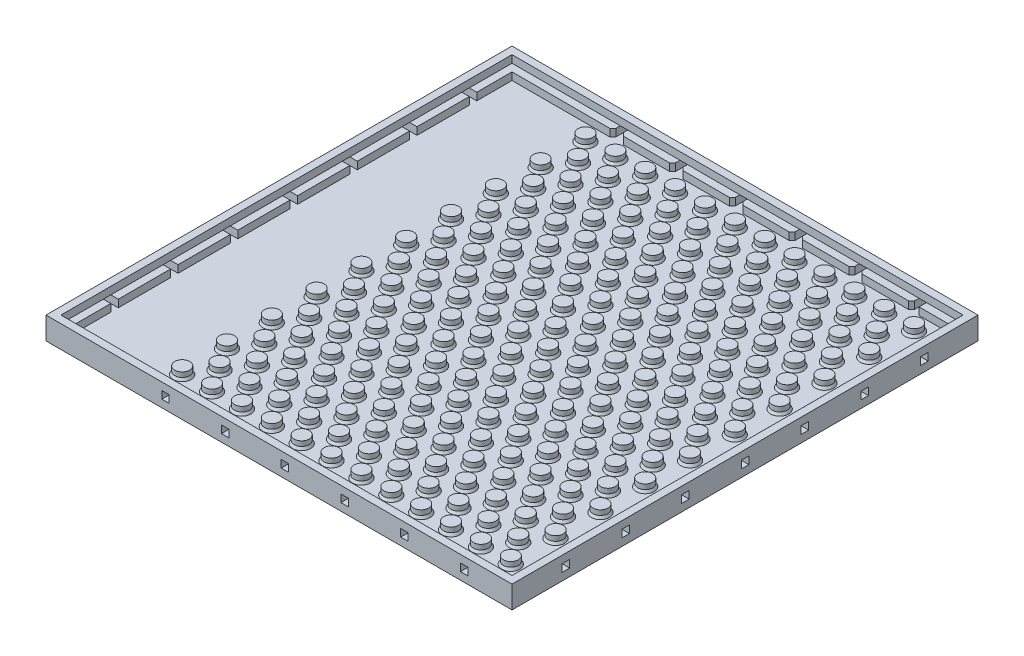
from build123d import *

# Parameters (mm, degrees)
OUTER_SHELL_EXTRUSION_DEPTH = 9.525
SHELL2_T                    = -6.35
SHELL2_THICKNESS_2_FACE_W   = 185.42
SHELL2_THICKNESS_2_FACE_H   = 185.42
SHELL2_THICKNESS_2_DEPTH    = 3.175
INSERTION_HOLES_REACH       = 242.845
SKETCH2_W                   = 3.175
SKETCH2_H                   = 3.2004
SKETCH3_R                   = 3.175
BOSS_EXTRUDE2_DEPTH         = 3.175
SKETCH4_W                   = 191.77
SKETCH4_H                   = 191.77
CUT_EXTRUDE3_DEPTH          = 3.17246
EXIT_HOLE1_REACH            = 224.856
SKETCH5_W                   = 3.175
SKETCH5_H                   = 3.2004
EXIT_HOLE2_REACH            = 224.856
SKETCH7_W                   = 3.175
SKETCH7_H                   = 3.2004
EXIT_HOLE3_REACH            = 242.845
SKETCH6_W                   = 3.175
SKETCH6_H                   = 3.2004
CHAMFER2_SIZE               = 1.27
CHAMFER3_SIZE               = 0.635
CHAMFER3_SIZE2              = 1.099852263


with BuildPart() as part:
    # Outer_Shell → Outer_Shell_Extrusion (new body)
    with BuildSketch(Plane(origin=(0, 0, 0), x_dir=(1, 0, 0), z_dir=(0, 1, 0))):
        Polygon((41.275, 61.504285714), (96.52, 61.504285714), (96.52, 51.979285714), (96.52, 45.629285714), (96.52, 26.579285714), (96.52, 20.229285714), (96.52, 1.179285714), (96.52, -5.170714286), (96.52, -24.220714286), (96.52, -30.570714286), (96.52, -136.615714286), (86.995, -136.615714286), (80.645, -136.615714286), (61.595, -136.615714286), (55.245, -136.615714286), (36.195, -136.615714286), (29.845, -136.615714286), (10.795, -136.615714286), (4.445, -136.615714286), (-101.6, -136.615714286), (-101.6, 61.504285714), (-41.275, 61.504285714), (-34.925, 61.504285714), (-15.875, 61.504285714), (-9.525, 61.504285714), (9.525, 61.504285714), (15.875, 61.504285714), (34.925, 61.504285714), align=None)
    extrude(amount=OUTER_SHELL_EXTRUSION_DEPTH)

    # Shell2
    shell2_openings = [part.faces().sort_by_distance(p)[0] for p in [
        (-2.54, 9.525, 37.555714286),
    ]]
    offset(amount=SHELL2_T, openings=shell2_openings, kind=Kind.INTERSECTION)

    # Shell2 thickness 2 face (on inner face of the shell) → Shell2 thickness 2 (cut)
    with BuildSketch(Plane(origin=(-2.54, 6.35, 37.555714286), x_dir=(0, 0, -1), z_dir=(0, -1, 0))):
        Rectangle(SHELL2_THICKNESS_2_FACE_W, SHELL2_THICKNESS_2_FACE_H)
    extrude(amount=SHELL2_THICKNESS_2_DEPTH, mode=Mode.SUBTRACT)

    # Sketch2 → Insertion_holes (cut, up to next)
    with BuildSketch(Plane.ZY.offset(101.6), mode=Mode.PRIVATE) as insertion_holes_sk1:
        with Locations((-38.580785714, 4.7752)):
            Rectangle(SKETCH2_W, SKETCH2_H)
    insertion_holes_tool1 = extrude(insertion_holes_sk1.sketch, amount=-INSERTION_HOLES_REACH, mode=Mode.PRIVATE) & part.part
    # Sketch2 → Insertion_holes (cut, up to next)
    with BuildSketch(Plane.ZY.offset(101.6), mode=Mode.PRIVATE) as insertion_holes_sk2:
        with Locations((-13.180785714, 4.7752)):
            Rectangle(SKETCH2_W, SKETCH2_H)
    insertion_holes_tool2 = extrude(insertion_holes_sk2.sketch, amount=-INSERTION_HOLES_REACH, mode=Mode.PRIVATE) & part.part
    # Sketch2 → Insertion_holes (cut, up to next)
    with BuildSketch(Plane.ZY.offset(101.6), mode=Mode.PRIVATE) as insertion_holes_sk3:
        with Locations((12.219214286, 4.7752)):
            Rectangle(SKETCH2_W, SKETCH2_H)
    insertion_holes_tool3 = extrude(insertion_holes_sk3.sketch, amount=-INSERTION_HOLES_REACH, mode=Mode.PRIVATE) & part.part
    # Sketch2 → Insertion_holes (cut, up to next)
    with BuildSketch(Plane.ZY.offset(101.6), mode=Mode.PRIVATE) as insertion_holes_sk4:
        with Locations((37.619214286, 4.7752)):
            Rectangle(SKETCH2_W, SKETCH2_H)
    insertion_holes_tool4 = extrude(insertion_holes_sk4.sketch, amount=-INSERTION_HOLES_REACH, mode=Mode.PRIVATE) & part.part
    # Sketch2 → Insertion_holes (cut, up to next)
    with BuildSketch(Plane.ZY.offset(101.6), mode=Mode.PRIVATE) as insertion_holes_sk5:
        with Locations((63.019214286, 4.7752)):
            Rectangle(SKETCH2_W, SKETCH2_H)
    insertion_holes_tool5 = extrude(insertion_holes_sk5.sketch, amount=-INSERTION_HOLES_REACH, mode=Mode.PRIVATE) & part.part
    # Sketch2 → Insertion_holes (cut, up to next)
    with BuildSketch(Plane.ZY.offset(101.6), mode=Mode.PRIVATE) as insertion_holes_sk6:
        with Locations((88.419214286, 4.7752)):
            Rectangle(SKETCH2_W, SKETCH2_H)
    insertion_holes_tool6 = extrude(insertion_holes_sk6.sketch, amount=-INSERTION_HOLES_REACH, mode=Mode.PRIVATE) & part.part
    # Sketch2 → Insertion_holes (cut, up to next)
    with BuildSketch(Plane.ZY.offset(101.6), mode=Mode.PRIVATE) as insertion_holes_sk7:
        with Locations((113.819214286, 4.7752)):
            Rectangle(SKETCH2_W, SKETCH2_H)
    insertion_holes_tool7 = extrude(insertion_holes_sk7.sketch, amount=-INSERTION_HOLES_REACH, mode=Mode.PRIVATE) & part.part
    add(insertion_holes_tool1.solids().sort_by_distance((-101.6, 4.7752, -38.580786))[0], mode=Mode.SUBTRACT)
    add(insertion_holes_tool2.solids().sort_by_distance((-101.6, 4.7752, -13.180786))[0], mode=Mode.SUBTRACT)
    add(insertion_holes_tool3.solids().sort_by_distance((-101.6, 4.7752, 12.219214))[0], mode=Mode.SUBTRACT)
    add(insertion_holes_tool4.solids().sort_by_distance((-101.6, 4.7752, 37.619214))[0], mode=Mode.SUBTRACT)
    add(insertion_holes_tool5.solids().sort_by_distance((-101.6, 4.7752, 63.019214))[0], mode=Mode.SUBTRACT)
    add(insertion_holes_tool6.solids().sort_by_distance((-101.6, 4.7752, 88.419214))[0], mode=Mode.SUBTRACT)
    add(insertion_holes_tool7.solids().sort_by_distance((-101.6, 4.7752, 113.819214))[0], mode=Mode.SUBTRACT)

    # Sketch3 → Boss-Extrude2 (add)
    with BuildSketch(Plane(origin=(0, 3.175, 0), x_dir=(1, 0, 0), z_dir=(0, 1, 0))):
        with Locations(Location((-57.15, -123.153714286, 0), (0, 0, 270))):
            Circle(SKETCH3_R)
        with Locations(Location((-50.8, -113.628714286, 0), (0, 0, 270))):
            Circle(SKETCH3_R)
        with Locations(Location((-44.45, -123.153714286, 0), (0, 0, 270))):
            Circle(SKETCH3_R)
        with Locations(Location((-38.1, -113.628714286, 0), (0, 0, 270))):
            Circle(SKETCH3_R)
        with Locations(Location((-31.75, -123.153714286, 0), (0, 0, 270))):
            Circle(SKETCH3_R)
        with Locations(Location((-25.4, -113.628714286, 0), (0, 0, 270))):
            Circle(SKETCH3_R)
        with Locations(Location((-19.05, -123.153714286, 0), (0, 0, 270))):
            Circle(SKETCH3_R)
        with Locations(Location((-12.7, -113.628714286, 0), (0, 0, 270))):
            Circle(SKETCH3_R)
        with Locations(Location((-6.35, -123.153714286, 0), (0, 0, 270))):
            Circle(SKETCH3_R)
        with Locations(Location((0, -113.628714286, 0), (0, 0, 270))):
            Circle(SKETCH3_R)
        with Locations(Location((6.35, -123.153714286, 0), (0, 0, 270))):
            Circle(SKETCH3_R)
        with Locations(Location((12.7, -113.628714286, 0), (0, 0, 270))):
            Circle(SKETCH3_R)
        with Locations(Location((19.05, -123.153714286, 0), (0, 0, 270))):
            Circle(SKETCH3_R)
        with Locations(Location((25.4, -113.628714286, 0), (0, 0, 270))):
            Circle(SKETCH3_R)
        with Locations(Location((31.75, -123.153714286, 0), (0, 0, 270))):
            Circle(SKETCH3_R)
        with Locations(Location((38.1, -113.628714286, 0), (0, 0, 270))):
            Circle(SKETCH3_R)
        with Locations(Location((44.45, -123.153714286, 0), (0, 0, 270))):
            Circle(SKETCH3_R)
        with Locations(Location((50.8, -113.628714286, 0), (0, 0, 270))):
            Circle(SKETCH3_R)
        with Locations(Location((57.15, -123.153714286, 0), (0, 0, 270))):
            Circle(SKETCH3_R)
        with Locations(Location((63.5, -113.628714286, 0), (0, 0, 270))):
            Circle(SKETCH3_R)
        with Locations(Location((69.85, -123.153714286, 0), (0, 0, 270))):
            Circle(SKETCH3_R)
        with Locations(Location((76.2, -113.628714286, 0), (0, 0, 270))):
            Circle(SKETCH3_R)
        with Locations(Location((-44.45, -104.103714286, 0), (0, 0, 270))):
            Circle(SKETCH3_R)
        with Locations(Location((-38.1, -94.578714286, 0), (0, 0, 270))):
            Circle(SKETCH3_R)
        with Locations(Location((-31.75, -104.103714286, 0), (0, 0, 270))):
            Circle(SKETCH3_R)
        with Locations(Location((-25.4, -94.578714286, 0), (0, 0, 270))):
            Circle(SKETCH3_R)
        with Locations(Location((-19.05, -104.103714286, 0), (0, 0, 270))):
            Circle(SKETCH3_R)
        with Locations(Location((-12.7, -94.578714286, 0), (0, 0, 270))):
            Circle(SKETCH3_R)
        with Locations(Location((-6.35, -104.103714286, 0), (0, 0, 270))):
            Circle(SKETCH3_R)
        with Locations(Location((0, -94.578714286, 0), (0, 0, 270))):
            Circle(SKETCH3_R)
        with Locations(Location((6.35, -104.103714286, 0), (0, 0, 270))):
            Circle(SKETCH3_R)
        with Locations(Location((12.7, -94.578714286, 0), (0, 0, 270))):
            Circle(SKETCH3_R)
        with Locations(Location((19.05, -104.103714286, 0), (0, 0, 270))):
            Circle(SKETCH3_R)
        with Locations(Location((25.4, -94.578714286, 0), (0, 0, 270))):
            Circle(SKETCH3_R)
        with Locations(Location((31.75, -104.103714286, 0), (0, 0, 270))):
            Circle(SKETCH3_R)
        with Locations(Location((38.1, -94.578714286, 0), (0, 0, 270))):
            Circle(SKETCH3_R)
        with Locations(Location((44.45, -104.103714286, 0), (0, 0, 270))):
            Circle(SKETCH3_R)
        with Locations(Location((50.8, -94.578714286, 0), (0, 0, 270))):
            Circle(SKETCH3_R)
        with Locations(Location((57.15, -104.103714286, 0), (0, 0, 270))):
            Circle(SKETCH3_R)
        with Locations(Location((63.5, -94.578714286, 0), (0, 0, 270))):
            Circle(SKETCH3_R)
        with Locations(Location((69.85, -104.103714286, 0), (0, 0, 270))):
            Circle(SKETCH3_R)
        with Locations(Location((76.2, -94.578714286, 0), (0, 0, 270))):
            Circle(SKETCH3_R)
        with Locations(Location((-44.45, -85.053714286, 0), (0, 0, 270))):
            Circle(SKETCH3_R)
        with Locations(Location((-38.1, -75.528714286, 0), (0, 0, 270))):
            Circle(SKETCH3_R)
        with Locations(Location((-31.75, -85.053714286, 0), (0, 0, 270))):
            Circle(SKETCH3_R)
        with Locations(Location((-25.4, -75.528714286, 0), (0, 0, 270))):
            Circle(SKETCH3_R)
        with Locations(Location((-19.05, -85.053714286, 0), (0, 0, 270))):
            Circle(SKETCH3_R)
        with Locations(Location((-12.7, -75.528714286, 0), (0, 0, 270))):
            Circle(SKETCH3_R)
        with Locations(Location((-6.35, -85.053714286, 0), (0, 0, 270))):
            Circle(SKETCH3_R)
        with Locations(Location((0, -75.528714286, 0), (0, 0, 270))):
            Circle(SKETCH3_R)
        with Locations(Location((6.35, -85.053714286, 0), (0, 0, 270))):
            Circle(SKETCH3_R)
        with Locations(Location((12.7, -75.528714286, 0), (0, 0, 270))):
            Circle(SKETCH3_R)
        with Locations(Location((19.05, -85.053714286, 0), (0, 0, 270))):
            Circle(SKETCH3_R)
        with Locations(Location((25.4, -75.528714286, 0), (0, 0, 270))):
            Circle(SKETCH3_R)
        with Locations(Location((31.75, -85.053714286, 0), (0, 0, 270))):
            Circle(SKETCH3_R)
        with Locations(Location((38.1, -75.528714286, 0), (0, 0, 270))):
            Circle(SKETCH3_R)
        with Locations(Location((44.45, -85.053714286, 0), (0, 0, 270))):
            Circle(SKETCH3_R)
        with Locations(Location((50.8, -75.528714286, 0), (0, 0, 270))):
            Circle(SKETCH3_R)
        with Locations(Location((57.15, -85.053714286, 0), (0, 0, 270))):
            Circle(SKETCH3_R)
        with Locations(Location((63.5, -75.528714286, 0), (0, 0, 270))):
            Circle(SKETCH3_R)
        with Locations(Location((69.85, -85.053714286, 0), (0, 0, 270))):
            Circle(SKETCH3_R)
        with Locations(Location((76.2, -75.528714286, 0), (0, 0, 270))):
            Circle(SKETCH3_R)
        with Locations(Location((-44.45, -66.003714286, 0), (0, 0, 270))):
            Circle(SKETCH3_R)
        with Locations(Location((-38.1, -56.478714286, 0), (0, 0, 270))):
            Circle(SKETCH3_R)
        with Locations(Location((-31.75, -66.003714286, 0), (0, 0, 270))):
            Circle(SKETCH3_R)
        with Locations(Location((-25.4, -56.478714286, 0), (0, 0, 270))):
            Circle(SKETCH3_R)
        with Locations(Location((-19.05, -66.003714286, 0), (0, 0, 270))):
            Circle(SKETCH3_R)
        with Locations(Location((-12.7, -56.478714286, 0), (0, 0, 270))):
            Circle(SKETCH3_R)
        with Locations(Location((-6.35, -66.003714286, 0), (0, 0, 270))):
            Circle(SKETCH3_R)
        with Locations(Location((0, -56.478714286, 0), (0, 0, 270))):
            Circle(SKETCH3_R)
        with Locations(Location((6.35, -66.003714286, 0), (0, 0, 270))):
            Circle(SKETCH3_R)
        with Locations(Location((12.7, -56.478714286, 0), (0, 0, 270))):
            Circle(SKETCH3_R)
        with Locations(Location((19.05, -66.003714286, 0), (0, 0, 270))):
            Circle(SKETCH3_R)
        with Locations(Location((25.4, -56.478714286, 0), (0, 0, 270))):
            Circle(SKETCH3_R)
        with Locations(Location((31.75, -66.003714286, 0), (0, 0, 270))):
            Circle(SKETCH3_R)
        with Locations(Location((38.1, -56.478714286, 0), (0, 0, 270))):
            Circle(SKETCH3_R)
        with Locations(Location((44.45, -66.003714286, 0), (0, 0, 270))):
            Circle(SKETCH3_R)
        with Locations(Location((50.8, -56.478714286, 0), (0, 0, 270))):
            Circle(SKETCH3_R)
        with Locations(Location((57.15, -66.003714286, 0), (0, 0, 270))):
            Circle(SKETCH3_R)
        with Locations(Location((63.5, -56.478714286, 0), (0, 0, 270))):
            Circle(SKETCH3_R)
        with Locations(Location((69.85, -66.003714286, 0), (0, 0, 270))):
            Circle(SKETCH3_R)
        with Locations(Location((76.2, -56.478714286, 0), (0, 0, 270))):
            Circle(SKETCH3_R)
        with Locations(Location((-44.45, -46.953714286, 0), (0, 0, 270))):
            Circle(SKETCH3_R)
        with Locations(Location((-38.1, -37.428714286, 0), (0, 0, 270))):
            Circle(SKETCH3_R)
        with Locations(Location((-31.75, -46.953714286, 0), (0, 0, 270))):
            Circle(SKETCH3_R)
        with Locations(Location((-25.4, -37.428714286, 0), (0, 0, 270))):
            Circle(SKETCH3_R)
        with Locations(Location((-19.05, -46.953714286, 0), (0, 0, 270))):
            Circle(SKETCH3_R)
        with Locations(Location((-12.7, -37.428714286, 0), (0, 0, 270))):
            Circle(SKETCH3_R)
        with Locations(Location((-6.35, -46.953714286, 0), (0, 0, 270))):
            Circle(SKETCH3_R)
        with Locations(Location((0, -37.428714286, 0), (0, 0, 270))):
            Circle(SKETCH3_R)
        with Locations(Location((6.35, -46.953714286, 0), (0, 0, 270))):
            Circle(SKETCH3_R)
        with Locations(Location((12.7, -37.428714286, 0), (0, 0, 270))):
            Circle(SKETCH3_R)
        with Locations(Location((19.05, -46.953714286, 0), (0, 0, 270))):
            Circle(SKETCH3_R)
        with Locations(Location((25.4, -37.428714286, 0), (0, 0, 270))):
            Circle(SKETCH3_R)
        with Locations(Location((31.75, -46.953714286, 0), (0, 0, 270))):
            Circle(SKETCH3_R)
        with Locations(Location((38.1, -37.428714286, 0), (0, 0, 270))):
            Circle(SKETCH3_R)
        with Locations(Location((44.45, -46.953714286, 0), (0, 0, 270))):
            Circle(SKETCH3_R)
        with Locations(Location((50.8, -37.428714286, 0), (0, 0, 270))):
            Circle(SKETCH3_R)
        with Locations(Location((57.15, -46.953714286, 0), (0, 0, 270))):
            Circle(SKETCH3_R)
        with Locations(Location((63.5, -37.428714286, 0), (0, 0, 270))):
            Circle(SKETCH3_R)
        with Locations(Location((69.85, -46.953714286, 0), (0, 0, 270))):
            Circle(SKETCH3_R)
        with Locations(Location((76.2, -37.428714286, 0), (0, 0, 270))):
            Circle(SKETCH3_R)
        with Locations(Location((-44.45, -27.903714286, 0), (0, 0, 270))):
            Circle(SKETCH3_R)
        with Locations(Location((-38.1, -18.378714286, 0), (0, 0, 270))):
            Circle(SKETCH3_R)
        with Locations(Location((-31.75, -27.903714286, 0), (0, 0, 270))):
            Circle(SKETCH3_R)
        with Locations(Location((-25.4, -18.378714286, 0), (0, 0, 270))):
            Circle(SKETCH3_R)
        with Locations(Location((-19.05, -27.903714286, 0), (0, 0, 270))):
            Circle(SKETCH3_R)
        with Locations(Location((-12.7, -18.378714286, 0), (0, 0, 270))):
            Circle(SKETCH3_R)
        with Locations(Location((-6.35, -27.903714286, 0), (0, 0, 270))):
            Circle(SKETCH3_R)
        with Locations(Location((0, -18.378714286, 0), (0, 0, 270))):
            Circle(SKETCH3_R)
        with Locations(Location((6.35, -27.903714286, 0), (0, 0, 270))):
            Circle(SKETCH3_R)
        with Locations(Location((12.7, -18.378714286, 0), (0, 0, 270))):
            Circle(SKETCH3_R)
        with Locations(Location((19.05, -27.903714286, 0), (0, 0, 270))):
            Circle(SKETCH3_R)
        with Locations(Location((25.4, -18.378714286, 0), (0, 0, 270))):
            Circle(SKETCH3_R)
        with Locations(Location((31.75, -27.903714286, 0), (0, 0, 270))):
            Circle(SKETCH3_R)
        with Locations(Location((38.1, -18.378714286, 0), (0, 0, 270))):
            Circle(SKETCH3_R)
        with Locations(Location((44.45, -27.903714286, 0), (0, 0, 270))):
            Circle(SKETCH3_R)
        with Locations(Location((50.8, -18.378714286, 0), (0, 0, 270))):
            Circle(SKETCH3_R)
        with Locations(Location((57.15, -27.903714286, 0), (0, 0, 270))):
            Circle(SKETCH3_R)
        with Locations(Location((63.5, -18.378714286, 0), (0, 0, 270))):
            Circle(SKETCH3_R)
        with Locations(Location((69.85, -27.903714286, 0), (0, 0, 270))):
            Circle(SKETCH3_R)
        with Locations(Location((76.2, -18.378714286, 0), (0, 0, 270))):
            Circle(SKETCH3_R)
        with Locations(Location((-44.45, -8.853714286, 0), (0, 0, 270))):
            Circle(SKETCH3_R)
        with Locations(Location((-38.1, 0.671285714, 0), (0, 0, 270))):
            Circle(SKETCH3_R)
        with Locations(Location((-31.75, -8.853714286, 0), (0, 0, 270))):
            Circle(SKETCH3_R)
        with Locations(Location((-25.4, 0.671285714, 0), (0, 0, 270))):
            Circle(SKETCH3_R)
        with Locations(Location((-19.05, -8.853714286, 0), (0, 0, 270))):
            Circle(SKETCH3_R)
        with Locations(Location((-12.7, 0.671285714, 0), (0, 0, 270))):
            Circle(SKETCH3_R)
        with Locations(Location((-6.35, -8.853714286, 0), (0, 0, 270))):
            Circle(SKETCH3_R)
        with Locations(Location((0, 0.671285714, 0), (0, 0, 270))):
            Circle(SKETCH3_R)
        with Locations(Location((6.35, -8.853714286, 0), (0, 0, 270))):
            Circle(SKETCH3_R)
        with Locations(Location((12.7, 0.671285714, 0), (0, 0, 270))):
            Circle(SKETCH3_R)
        with Locations(Location((19.05, -8.853714286, 0), (0, 0, 270))):
            Circle(SKETCH3_R)
        with Locations(Location((25.4, 0.671285714, 0), (0, 0, 270))):
            Circle(SKETCH3_R)
        with Locations(Location((31.75, -8.853714286, 0), (0, 0, 270))):
            Circle(SKETCH3_R)
        with Locations(Location((38.1, 0.671285714, 0), (0, 0, 270))):
            Circle(SKETCH3_R)
        with Locations(Location((44.45, -8.853714286, 0), (0, 0, 270))):
            Circle(SKETCH3_R)
        with Locations(Location((50.8, 0.671285714, 0), (0, 0, 270))):
            Circle(SKETCH3_R)
        with Locations(Location((57.15, -8.853714286, 0), (0, 0, 270))):
            Circle(SKETCH3_R)
        with Locations(Location((63.5, 0.671285714, 0), (0, 0, 270))):
            Circle(SKETCH3_R)
        with Locations(Location((69.85, -8.853714286, 0), (0, 0, 270))):
            Circle(SKETCH3_R)
        with Locations(Location((76.2, 0.671285714, 0), (0, 0, 270))):
            Circle(SKETCH3_R)
        with Locations(Location((-44.45, 10.196285714, 0), (0, 0, 270))):
            Circle(SKETCH3_R)
        with Locations(Location((-38.1, 19.721285714, 0), (0, 0, 270))):
            Circle(SKETCH3_R)
        with Locations(Location((-31.75, 10.196285714, 0), (0, 0, 270))):
            Circle(SKETCH3_R)
        with Locations(Location((-25.4, 19.721285714, 0), (0, 0, 270))):
            Circle(SKETCH3_R)
        with Locations(Location((-19.05, 10.196285714, 0), (0, 0, 270))):
            Circle(SKETCH3_R)
        with Locations(Location((-12.7, 19.721285714, 0), (0, 0, 270))):
            Circle(SKETCH3_R)
        with Locations(Location((-6.35, 10.196285714, 0), (0, 0, 270))):
            Circle(SKETCH3_R)
        with Locations(Location((0, 19.721285714, 0), (0, 0, 270))):
            Circle(SKETCH3_R)
        with Locations(Location((6.35, 10.196285714, 0), (0, 0, 270))):
            Circle(SKETCH3_R)
        with Locations(Location((12.7, 19.721285714, 0), (0, 0, 270))):
            Circle(SKETCH3_R)
        with Locations(Location((19.05, 10.196285714, 0), (0, 0, 270))):
            Circle(SKETCH3_R)
        with Locations(Location((25.4, 19.721285714, 0), (0, 0, 270))):
            Circle(SKETCH3_R)
        with Locations(Location((31.75, 10.196285714, 0), (0, 0, 270))):
            Circle(SKETCH3_R)
        with Locations(Location((38.1, 19.721285714, 0), (0, 0, 270))):
            Circle(SKETCH3_R)
        with Locations(Location((44.45, 10.196285714, 0), (0, 0, 270))):
            Circle(SKETCH3_R)
        with Locations(Location((50.8, 19.721285714, 0), (0, 0, 270))):
            Circle(SKETCH3_R)
        with Locations(Location((57.15, 10.196285714, 0), (0, 0, 270))):
            Circle(SKETCH3_R)
        with Locations(Location((63.5, 19.721285714, 0), (0, 0, 270))):
            Circle(SKETCH3_R)
        with Locations(Location((69.85, 10.196285714, 0), (0, 0, 270))):
            Circle(SKETCH3_R)
        with Locations(Location((76.2, 19.721285714, 0), (0, 0, 270))):
            Circle(SKETCH3_R)
        with Locations(Location((-44.45, 29.246285714, 0), (0, 0, 270))):
            Circle(SKETCH3_R)
        with Locations(Location((-38.1, 38.771285714, 0), (0, 0, 270))):
            Circle(SKETCH3_R)
        with Locations(Location((-31.75, 29.246285714, 0), (0, 0, 270))):
            Circle(SKETCH3_R)
        with Locations(Location((-25.4, 38.771285714, 0), (0, 0, 270))):
            Circle(SKETCH3_R)
        with Locations(Location((-19.05, 29.246285714, 0), (0, 0, 270))):
            Circle(SKETCH3_R)
        with Locations(Location((-12.7, 38.771285714, 0), (0, 0, 270))):
            Circle(SKETCH3_R)
        with Locations(Location((-6.35, 29.246285714, 0), (0, 0, 270))):
            Circle(SKETCH3_R)
        with Locations(Location((0, 38.771285714, 0), (0, 0, 270))):
            Circle(SKETCH3_R)
        with Locations(Location((6.35, 29.246285714, 0), (0, 0, 270))):
            Circle(SKETCH3_R)
        with Locations(Location((12.7, 38.771285714, 0), (0, 0, 270))):
            Circle(SKETCH3_R)
        with Locations(Location((19.05, 29.246285714, 0), (0, 0, 270))):
            Circle(SKETCH3_R)
        with Locations(Location((25.4, 38.771285714, 0), (0, 0, 270))):
            Circle(SKETCH3_R)
        with Locations(Location((31.75, 29.246285714, 0), (0, 0, 270))):
            Circle(SKETCH3_R)
        with Locations(Location((38.1, 38.771285714, 0), (0, 0, 270))):
            Circle(SKETCH3_R)
        with Locations(Location((44.45, 29.246285714, 0), (0, 0, 270))):
            Circle(SKETCH3_R)
        with Locations(Location((50.8, 38.771285714, 0), (0, 0, 270))):
            Circle(SKETCH3_R)
        with Locations(Location((57.15, 29.246285714, 0), (0, 0, 270))):
            Circle(SKETCH3_R)
        with Locations(Location((63.5, 38.771285714, 0), (0, 0, 270))):
            Circle(SKETCH3_R)
        with Locations(Location((69.85, 29.246285714, 0), (0, 0, 270))):
            Circle(SKETCH3_R)
        with Locations(Location((76.2, 38.771285714, 0), (0, 0, 270))):
            Circle(SKETCH3_R)
        with Locations(Location((-44.45, 48.296285714, 0), (0, 0, 270))):
            Circle(SKETCH3_R)
        with Locations(Location((-31.75, 48.296285714, 0), (0, 0, 270))):
            Circle(SKETCH3_R)
        with Locations(Location((-19.05, 48.296285714, 0), (0, 0, 270))):
            Circle(SKETCH3_R)
        with Locations(Location((-6.35, 48.296285714, 0), (0, 0, 270))):
            Circle(SKETCH3_R)
        with Locations(Location((6.35, 48.296285714, 0), (0, 0, 270))):
            Circle(SKETCH3_R)
        with Locations(Location((19.05, 48.296285714, 0), (0, 0, 270))):
            Circle(SKETCH3_R)
        with Locations(Location((31.75, 48.296285714, 0), (0, 0, 270))):
            Circle(SKETCH3_R)
        with Locations(Location((44.45, 48.296285714, 0), (0, 0, 270))):
            Circle(SKETCH3_R)
        with Locations(Location((57.15, 48.296285714, 0), (0, 0, 270))):
            Circle(SKETCH3_R)
        with Locations(Location((69.85, 48.296285714, 0), (0, 0, 270))):
            Circle(SKETCH3_R)
        with Locations(Location((-57.15, -104.103714286, 0), (0, 0, 270))):
            Circle(SKETCH3_R)
        with Locations(Location((-50.8, -94.578714286, 0), (0, 0, 270))):
            Circle(SKETCH3_R)
        with Locations(Location((-57.15, -85.053714286, 0), (0, 0, 270))):
            Circle(SKETCH3_R)
        with Locations(Location((-50.8, -75.528714286, 0), (0, 0, 270))):
            Circle(SKETCH3_R)
        with Locations(Location((-57.15, -66.003714286, 0), (0, 0, 270))):
            Circle(SKETCH3_R)
        with Locations(Location((-50.8, -56.478714286, 0), (0, 0, 270))):
            Circle(SKETCH3_R)
        with Locations(Location((-57.15, -46.953714286, 0), (0, 0, 270))):
            Circle(SKETCH3_R)
        with Locations(Location((-50.8, -37.428714286, 0), (0, 0, 270))):
            Circle(SKETCH3_R)
        with Locations(Location((-57.15, -27.903714286, 0), (0, 0, 270))):
            Circle(SKETCH3_R)
        with Locations(Location((-50.8, -18.378714286, 0), (0, 0, 270))):
            Circle(SKETCH3_R)
        with Locations(Location((-57.15, -8.853714286, 0), (0, 0, 270))):
            Circle(SKETCH3_R)
        with Locations(Location((-50.8, 0.671285714, 0), (0, 0, 270))):
            Circle(SKETCH3_R)
        with Locations(Location((-57.15, 10.196285714, 0), (0, 0, 270))):
            Circle(SKETCH3_R)
        with Locations(Location((-50.8, 19.721285714, 0), (0, 0, 270))):
            Circle(SKETCH3_R)
        with Locations(Location((-57.15, 29.246285714, 0), (0, 0, 270))):
            Circle(SKETCH3_R)
        with Locations(Location((-50.8, 38.771285714, 0), (0, 0, 270))):
            Circle(SKETCH3_R)
        with Locations(Location((-57.15, 48.296285714, 0), (0, 0, 270))):
            Circle(SKETCH3_R)
        with Locations(Location((82.55, -123.153714286, 0), (0, 0, 270))):
            Circle(SKETCH3_R)
        with Locations(Location((82.55, -104.103714286, 0), (0, 0, 270))):
            Circle(SKETCH3_R)
        with Locations(Location((82.55, -85.053714286, 0), (0, 0, 270))):
            Circle(SKETCH3_R)
        with Locations(Location((82.55, -66.003714286, 0), (0, 0, 270))):
            Circle(SKETCH3_R)
        with Locations(Location((82.55, -46.953714286, 0), (0, 0, 270))):
            Circle(SKETCH3_R)
        with Locations(Location((82.55, -27.903714286, 0), (0, 0, 270))):
            Circle(SKETCH3_R)
        with Locations(Location((82.55, -8.853714286, 0), (0, 0, 270))):
            Circle(SKETCH3_R)
        with Locations(Location((82.55, 10.196285714, 0), (0, 0, 270))):
            Circle(SKETCH3_R)
        with Locations(Location((82.55, 29.246285714, 0), (0, 0, 270))):
            Circle(SKETCH3_R)
        with Locations(Location((82.55, 48.296285714, 0), (0, 0, 270))):
            Circle(SKETCH3_R)
    extrude(amount=BOSS_EXTRUDE2_DEPTH)

    # Sketch4 → Cut-Extrude3 (cut)
    with BuildSketch(Plane(origin=(0, 9.525, 0), x_dir=(1, 0, 0), z_dir=(0, 1, 0))):
        with Locations((-2.54, -37.555714286)):
            Rectangle(SKETCH4_W, SKETCH4_H)
    extrude(amount=-CUT_EXTRUDE3_DEPTH, mode=Mode.SUBTRACT)

    # Sketch5 → Exit Hole1 (cut, up to next)
    with BuildSketch(Plane.XY.offset(136.615714286), mode=Mode.PRIVATE) as exit_hole1_sk1:
        with Locations((-50.8, 4.7752)):
            Rectangle(SKETCH5_W, SKETCH5_H)
    exit_hole1_tool1 = extrude(exit_hole1_sk1.sketch, amount=-EXIT_HOLE1_REACH, mode=Mode.PRIVATE) & part.part
    # Sketch5 → Exit Hole1 (cut, up to next)
    with BuildSketch(Plane.XY.offset(136.615714286), mode=Mode.PRIVATE) as exit_hole1_sk2:
        with Locations((-25.4, 4.7752)):
            Rectangle(SKETCH5_W, SKETCH5_H)
    exit_hole1_tool2 = extrude(exit_hole1_sk2.sketch, amount=-EXIT_HOLE1_REACH, mode=Mode.PRIVATE) & part.part
    # Sketch5 → Exit Hole1 (cut, up to next)
    with BuildSketch(Plane.XY.offset(136.615714286), mode=Mode.PRIVATE) as exit_hole1_sk3:
        with Locations((0, 4.7752)):
            Rectangle(SKETCH5_W, SKETCH5_H)
    exit_hole1_tool3 = extrude(exit_hole1_sk3.sketch, amount=-EXIT_HOLE1_REACH, mode=Mode.PRIVATE) & part.part
    # Sketch5 → Exit Hole1 (cut, up to next)
    with BuildSketch(Plane.XY.offset(136.615714286), mode=Mode.PRIVATE) as exit_hole1_sk4:
        with Locations((25.4, 4.7752)):
            Rectangle(SKETCH5_W, SKETCH5_H)
    exit_hole1_tool4 = extrude(exit_hole1_sk4.sketch, amount=-EXIT_HOLE1_REACH, mode=Mode.PRIVATE) & part.part
    # Sketch5 → Exit Hole1 (cut, up to next)
    with BuildSketch(Plane.XY.offset(136.615714286), mode=Mode.PRIVATE) as exit_hole1_sk5:
        with Locations((50.8, 4.7752)):
            Rectangle(SKETCH5_W, SKETCH5_H)
    exit_hole1_tool5 = extrude(exit_hole1_sk5.sketch, amount=-EXIT_HOLE1_REACH, mode=Mode.PRIVATE) & part.part
    # Sketch5 → Exit Hole1 (cut, up to next)
    with BuildSketch(Plane.XY.offset(136.615714286), mode=Mode.PRIVATE) as exit_hole1_sk6:
        with Locations((76.2, 4.7752)):
            Rectangle(SKETCH5_W, SKETCH5_H)
    exit_hole1_tool6 = extrude(exit_hole1_sk6.sketch, amount=-EXIT_HOLE1_REACH, mode=Mode.PRIVATE) & part.part
    add(exit_hole1_tool1.solids().sort_by_distance((-50.8, 4.7752, 136.615714))[0], mode=Mode.SUBTRACT)
    add(exit_hole1_tool2.solids().sort_by_distance((-25.4, 4.7752, 136.615714))[0], mode=Mode.SUBTRACT)
    add(exit_hole1_tool3.solids().sort_by_distance((0, 4.7752, 136.615714))[0], mode=Mode.SUBTRACT)
    add(exit_hole1_tool4.solids().sort_by_distance((25.4, 4.7752, 136.615714))[0], mode=Mode.SUBTRACT)
    add(exit_hole1_tool5.solids().sort_by_distance((50.8, 4.7752, 136.615714))[0], mode=Mode.SUBTRACT)
    add(exit_hole1_tool6.solids().sort_by_distance((76.2, 4.7752, 136.615714))[0], mode=Mode.SUBTRACT)

    # Sketch7 → Exit Hole2 (cut, up to next)
    with BuildSketch(Plane(origin=(0, 0, -61.504285714), x_dir=(-1, 0, 0), z_dir=(0, 0, -1)), mode=Mode.PRIVATE) as exit_hole2_sk1:
        with Locations((50.8, 4.7752)):
            Rectangle(SKETCH7_W, SKETCH7_H)
    exit_hole2_tool1 = extrude(exit_hole2_sk1.sketch, amount=-EXIT_HOLE2_REACH, mode=Mode.PRIVATE) & part.part
    # Sketch7 → Exit Hole2 (cut, up to next)
    with BuildSketch(Plane(origin=(0, 0, -61.504285714), x_dir=(-1, 0, 0), z_dir=(0, 0, -1)), mode=Mode.PRIVATE) as exit_hole2_sk2:
        with Locations((25.4, 4.7752)):
            Rectangle(SKETCH7_W, SKETCH7_H)
    exit_hole2_tool2 = extrude(exit_hole2_sk2.sketch, amount=-EXIT_HOLE2_REACH, mode=Mode.PRIVATE) & part.part
    # Sketch7 → Exit Hole2 (cut, up to next)
    with BuildSketch(Plane(origin=(0, 0, -61.504285714), x_dir=(-1, 0, 0), z_dir=(0, 0, -1)), mode=Mode.PRIVATE) as exit_hole2_sk3:
        with Locations((0, 4.7752)):
            Rectangle(SKETCH7_W, SKETCH7_H)
    exit_hole2_tool3 = extrude(exit_hole2_sk3.sketch, amount=-EXIT_HOLE2_REACH, mode=Mode.PRIVATE) & part.part
    # Sketch7 → Exit Hole2 (cut, up to next)
    with BuildSketch(Plane(origin=(0, 0, -61.504285714), x_dir=(-1, 0, 0), z_dir=(0, 0, -1)), mode=Mode.PRIVATE) as exit_hole2_sk4:
        with Locations((-25.4, 4.7752)):
            Rectangle(SKETCH7_W, SKETCH7_H)
    exit_hole2_tool4 = extrude(exit_hole2_sk4.sketch, amount=-EXIT_HOLE2_REACH, mode=Mode.PRIVATE) & part.part
    # Sketch7 → Exit Hole2 (cut, up to next)
    with BuildSketch(Plane(origin=(0, 0, -61.504285714), x_dir=(-1, 0, 0), z_dir=(0, 0, -1)), mode=Mode.PRIVATE) as exit_hole2_sk5:
        with Locations((-50.8, 4.7752)):
            Rectangle(SKETCH7_W, SKETCH7_H)
    exit_hole2_tool5 = extrude(exit_hole2_sk5.sketch, amount=-EXIT_HOLE2_REACH, mode=Mode.PRIVATE) & part.part
    # Sketch7 → Exit Hole2 (cut, up to next)
    with BuildSketch(Plane(origin=(0, 0, -61.504285714), x_dir=(-1, 0, 0), z_dir=(0, 0, -1)), mode=Mode.PRIVATE) as exit_hole2_sk6:
        with Locations((-76.2, 4.7752)):
            Rectangle(SKETCH7_W, SKETCH7_H)
    exit_hole2_tool6 = extrude(exit_hole2_sk6.sketch, amount=-EXIT_HOLE2_REACH, mode=Mode.PRIVATE) & part.part
    add(exit_hole2_tool1.solids().sort_by_distance((-50.8, 4.7752, -61.504286))[0], mode=Mode.SUBTRACT)
    add(exit_hole2_tool2.solids().sort_by_distance((-25.4, 4.7752, -61.504286))[0], mode=Mode.SUBTRACT)
    add(exit_hole2_tool3.solids().sort_by_distance((0, 4.7752, -61.504286))[0], mode=Mode.SUBTRACT)
    add(exit_hole2_tool4.solids().sort_by_distance((25.4, 4.7752, -61.504286))[0], mode=Mode.SUBTRACT)
    add(exit_hole2_tool5.solids().sort_by_distance((50.8, 4.7752, -61.504286))[0], mode=Mode.SUBTRACT)
    add(exit_hole2_tool6.solids().sort_by_distance((76.2, 4.7752, -61.504286))[0], mode=Mode.SUBTRACT)

    # Sketch6 → Exit Hole3 (cut, up to next)
    with BuildSketch(Plane(origin=(96.52, 0, 0), x_dir=(0, 0, -1), z_dir=(1, 0, 0)), mode=Mode.PRIVATE) as exit_hole3_sk1:
        with Locations((-88.292214286, 4.7752)):
            Rectangle(SKETCH6_W, SKETCH6_H)
    exit_hole3_tool1 = extrude(exit_hole3_sk1.sketch, amount=-EXIT_HOLE3_REACH, mode=Mode.PRIVATE) & part.part
    # Sketch6 → Exit Hole3 (cut, up to next)
    with BuildSketch(Plane(origin=(96.52, 0, 0), x_dir=(0, 0, -1), z_dir=(1, 0, 0)), mode=Mode.PRIVATE) as exit_hole3_sk2:
        with Locations((-113.692214286, 4.7752)):
            Rectangle(SKETCH6_W, SKETCH6_H)
    exit_hole3_tool2 = extrude(exit_hole3_sk2.sketch, amount=-EXIT_HOLE3_REACH, mode=Mode.PRIVATE) & part.part
    # Sketch6 → Exit Hole3 (cut, up to next)
    with BuildSketch(Plane(origin=(96.52, 0, 0), x_dir=(0, 0, -1), z_dir=(1, 0, 0)), mode=Mode.PRIVATE) as exit_hole3_sk3:
        with Locations((-62.892214286, 4.7752)):
            Rectangle(SKETCH6_W, SKETCH6_H)
    exit_hole3_tool3 = extrude(exit_hole3_sk3.sketch, amount=-EXIT_HOLE3_REACH, mode=Mode.PRIVATE) & part.part
    # Sketch6 → Exit Hole3 (cut, up to next)
    with BuildSketch(Plane(origin=(96.52, 0, 0), x_dir=(0, 0, -1), z_dir=(1, 0, 0)), mode=Mode.PRIVATE) as exit_hole3_sk4:
        with Locations((-37.492214286, 4.7752)):
            Rectangle(SKETCH6_W, SKETCH6_H)
    exit_hole3_tool4 = extrude(exit_hole3_sk4.sketch, amount=-EXIT_HOLE3_REACH, mode=Mode.PRIVATE) & part.part
    # Sketch6 → Exit Hole3 (cut, up to next)
    with BuildSketch(Plane(origin=(96.52, 0, 0), x_dir=(0, 0, -1), z_dir=(1, 0, 0)), mode=Mode.PRIVATE) as exit_hole3_sk5:
        with Locations((-12.092214286, 4.7752)):
            Rectangle(SKETCH6_W, SKETCH6_H)
    exit_hole3_tool5 = extrude(exit_hole3_sk5.sketch, amount=-EXIT_HOLE3_REACH, mode=Mode.PRIVATE) & part.part
    # Sketch6 → Exit Hole3 (cut, up to next)
    with BuildSketch(Plane(origin=(96.52, 0, 0), x_dir=(0, 0, -1), z_dir=(1, 0, 0)), mode=Mode.PRIVATE) as exit_hole3_sk6:
        with Locations((13.307785714, 4.7752)):
            Rectangle(SKETCH6_W, SKETCH6_H)
    exit_hole3_tool6 = extrude(exit_hole3_sk6.sketch, amount=-EXIT_HOLE3_REACH, mode=Mode.PRIVATE) & part.part
    # Sketch6 → Exit Hole3 (cut, up to next)
    with BuildSketch(Plane(origin=(96.52, 0, 0), x_dir=(0, 0, -1), z_dir=(1, 0, 0)), mode=Mode.PRIVATE) as exit_hole3_sk7:
        with Locations((38.707785714, 4.7752)):
            Rectangle(SKETCH6_W, SKETCH6_H)
    exit_hole3_tool7 = extrude(exit_hole3_sk7.sketch, amount=-EXIT_HOLE3_REACH, mode=Mode.PRIVATE) & part.part
    add(exit_hole3_tool1.solids().sort_by_distance((96.52, 4.7752, 88.292214))[0], mode=Mode.SUBTRACT)
    add(exit_hole3_tool2.solids().sort_by_distance((96.52, 4.7752, 113.692214))[0], mode=Mode.SUBTRACT)
    add(exit_hole3_tool3.solids().sort_by_distance((96.52, 4.7752, 62.892214))[0], mode=Mode.SUBTRACT)
    add(exit_hole3_tool4.solids().sort_by_distance((96.52, 4.7752, 37.492214))[0], mode=Mode.SUBTRACT)
    add(exit_hole3_tool5.solids().sort_by_distance((96.52, 4.7752, 12.092214))[0], mode=Mode.SUBTRACT)
    add(exit_hole3_tool6.solids().sort_by_distance((96.52, 4.7752, -13.307786))[0], mode=Mode.SUBTRACT)
    add(exit_hole3_tool7.solids().sort_by_distance((96.52, 4.7752, -38.707786))[0], mode=Mode.SUBTRACT)

    # Chamfer2
    chamfer2_edges = [part.edges().sort_by_distance(p)[0] for p in [
        (74.6125, 4.76377, 130.265714286),
        (77.7875, 4.76377, 130.265714286),
        (49.2125, 4.76377, 130.265714286),
        (52.3875, 4.76377, 130.265714286),
        (23.8125, 4.76377, 130.265714286),
        (26.9875, 4.76377, 130.265714286),
        (-1.5875, 4.76377, 130.265714286),
        (1.5875, 4.76377, 130.265714286),
        (-52.3875, 4.76377, 130.265714286),
        (-49.2125, 4.76377, 130.265714286),
        (-26.9875, 4.76377, 130.265714286),
        (-23.8125, 4.76377, 130.265714286),
        (74.6125, 4.76377, -55.154285714),
        (52.3875, 4.76377, -55.154285714),
        (49.2125, 4.76377, -55.154285714),
        (26.9875, 4.76377, -55.154285714),
        (23.8125, 4.76377, -55.154285714),
        (1.5875, 4.76377, -55.154285714),
        (-1.5875, 4.76377, -55.154285714),
        (-49.2125, 4.76377, -55.154285714),
        (-52.3875, 4.76377, -55.154285714),
        (-23.8125, 4.76377, -55.154285714),
        (-26.9875, 4.76377, -55.154285714),
        (90.17, 4.76377, 115.279714286),
        (90.17, 4.76377, 112.104714286),
        (90.17, 4.76377, 89.879714286),
        (90.17, 4.76377, 86.704714286),
        (90.17, 4.76377, 64.479714286),
        (90.17, 4.76377, 61.304714286),
        (90.17, 4.76377, 39.079714286),
        (90.17, 4.76377, 35.904714286),
        (90.17, 4.76377, 13.679714286),
        (90.17, 4.76377, 10.504714286),
        (90.17, 4.76377, -11.720285714),
        (90.17, 4.76377, -14.895285714),
        (90.17, 4.76377, -37.120285714),
        (90.17, 4.76377, -40.295285714),
    ]]
    chamfer(chamfer2_edges, length=CHAMFER2_SIZE)

    # Chamfer3
    chamfer3_edges = [part.edges().sort_by_distance(p)[0] for p in [
        (-25.4, 3.175, 34.253714286),
        (-19.05, 3.175, 43.778714286),
        (-12.7, 3.175, 34.253714286),
        (-6.35, 3.175, 43.778714286),
        (76.2, 3.175, 53.303714286),
        (-44.45, 3.175, 43.778714286),
        (-38.1, 3.175, 34.253714286),
        (-31.75, 3.175, 43.778714286),
        (25.4, 3.175, 34.253714286),
        (31.75, 3.175, 43.778714286),
        (38.1, 3.175, 34.253714286),
        (44.45, 3.175, 43.778714286),
        (0, 3.175, 34.253714286),
        (6.35, 3.175, 43.778714286),
        (12.7, 3.175, 34.253714286),
        (19.05, 3.175, 43.778714286),
        (0, 3.175, 53.303714286),
        (6.35, 3.175, 62.828714286),
        (12.7, 3.175, 53.303714286),
        (19.05, 3.175, 62.828714286),
        (-25.4, 3.175, 53.303714286),
        (-19.05, 3.175, 62.828714286),
        (-12.7, 3.175, 53.303714286),
        (-6.35, 3.175, 62.828714286),
        (50.8, 3.175, 53.303714286),
        (57.15, 3.175, 62.828714286),
        (63.5, 3.175, 53.303714286),
        (69.85, 3.175, 62.828714286),
        (25.4, 3.175, 53.303714286),
        (31.75, 3.175, 62.828714286),
        (38.1, 3.175, 53.303714286),
        (44.45, 3.175, 62.828714286),
        (50.8, 3.175, 15.203714286),
        (57.15, 3.175, 24.728714286),
        (63.5, 3.175, 15.203714286),
        (69.85, 3.175, 24.728714286),
        (25.4, 3.175, 15.203714286),
        (31.75, 3.175, 24.728714286),
        (38.1, 3.175, 15.203714286),
        (44.45, 3.175, 24.728714286),
        (-25.4, 3.175, -3.846285714),
        (-19.05, 3.175, 5.678714286),
        (-12.7, 3.175, -3.846285714),
        (-6.35, 3.175, 5.678714286),
        (76.2, 3.175, 15.203714286),
        (-44.45, 3.175, 5.678714286),
        (-38.1, 3.175, -3.846285714),
        (-31.75, 3.175, 5.678714286),
        (76.2, 3.175, 34.253714286),
        (-44.45, 3.175, 24.728714286),
        (-38.1, 3.175, 15.203714286),
        (-31.75, 3.175, 24.728714286),
        (50.8, 3.175, 34.253714286),
        (57.15, 3.175, 43.778714286),
        (63.5, 3.175, 34.253714286),
        (69.85, 3.175, 43.778714286),
        (0, 3.175, 15.203714286),
        (6.35, 3.175, 24.728714286),
        (12.7, 3.175, 15.203714286),
        (19.05, 3.175, 24.728714286),
        (-25.4, 3.175, 15.203714286),
        (-19.05, 3.175, 24.728714286),
        (-12.7, 3.175, 15.203714286),
        (-6.35, 3.175, 24.728714286),
        (76.2, 3.175, 110.453714286),
        (-44.45, 3.175, 100.928714286),
        (-38.1, 3.175, 91.403714286),
        (-31.75, 3.175, 100.928714286),
        (50.8, 3.175, 110.453714286),
        (57.15, 3.175, 119.978714286),
        (63.5, 3.175, 110.453714286),
        (69.85, 3.175, 119.978714286),
        (0, 3.175, 91.403714286),
        (6.35, 3.175, 100.928714286),
        (12.7, 3.175, 91.403714286),
        (19.05, 3.175, 100.928714286),
        (-25.4, 3.175, 91.403714286),
        (-19.05, 3.175, 100.928714286),
        (-12.7, 3.175, 91.403714286),
        (-6.35, 3.175, 100.928714286),
        (-25.4, 3.175, 110.453714286),
        (-19.05, 3.175, 119.978714286),
        (-12.7, 3.175, 110.453714286),
        (-6.35, 3.175, 119.978714286),
        (-50.8, 3.175, 110.453714286),
        (-44.45, 3.175, 119.978714286),
        (-38.1, 3.175, 110.453714286),
        (-31.75, 3.175, 119.978714286),
        (25.4, 3.175, 110.453714286),
        (31.75, 3.175, 119.978714286),
        (38.1, 3.175, 110.453714286),
        (44.45, 3.175, 119.978714286),
        (0, 3.175, 110.453714286),
        (6.35, 3.175, 119.978714286),
        (12.7, 3.175, 110.453714286),
        (19.05, 3.175, 119.978714286),
        (25.4, 3.175, 72.353714286),
        (31.75, 3.175, 81.878714286),
        (38.1, 3.175, 72.353714286),
        (44.45, 3.175, 81.878714286),
        (0, 3.175, 72.353714286),
        (6.35, 3.175, 81.878714286),
        (12.7, 3.175, 72.353714286),
        (19.05, 3.175, 81.878714286),
        (76.2, 3.175, 72.353714286),
        (-44.45, 3.175, 62.828714286),
        (-38.1, 3.175, 53.303714286),
        (-31.75, 3.175, 62.828714286),
        (50.8, 3.175, 72.353714286),
        (57.15, 3.175, 81.878714286),
        (63.5, 3.175, 72.353714286),
        (69.85, 3.175, 81.878714286),
        (50.8, 3.175, 91.403714286),
        (57.15, 3.175, 100.928714286),
        (63.5, 3.175, 91.403714286),
        (69.85, 3.175, 100.928714286),
        (25.4, 3.175, 91.403714286),
        (31.75, 3.175, 100.928714286),
        (38.1, 3.175, 91.403714286),
        (44.45, 3.175, 100.928714286),
        (-25.4, 3.175, 72.353714286),
        (-19.05, 3.175, 81.878714286),
        (-12.7, 3.175, 72.353714286),
        (-6.35, 3.175, 81.878714286),
        (76.2, 3.175, 91.403714286),
        (-44.45, 3.175, 81.878714286),
        (-38.1, 3.175, 72.353714286),
        (-31.75, 3.175, 81.878714286),
        (82.55, 3.175, -32.421285714),
        (82.55, 3.175, -51.471285714),
        (82.55, 3.175, -13.371285714),
        (82.55, 3.175, 5.678714286),
        (82.55, 3.175, 24.728714286),
        (82.55, 3.175, 43.778714286),
        (82.55, 3.175, 62.828714286),
        (82.55, 3.175, 81.878714286),
        (82.55, 3.175, 100.928714286),
        (82.55, 3.175, 119.978714286),
        (-57.15, 3.175, -51.471285714),
        (-50.8, 3.175, -41.946285714),
        (-57.15, 3.175, -32.421285714),
        (-50.8, 3.175, -22.896285714),
        (-57.15, 3.175, -13.371285714),
        (-50.8, 3.175, -3.846285714),
        (-57.15, 3.175, 5.678714286),
        (-50.8, 3.175, 15.203714286),
        (-57.15, 3.175, 24.728714286),
        (-50.8, 3.175, 34.253714286),
        (-57.15, 3.175, 43.778714286),
        (-50.8, 3.175, 53.303714286),
        (-57.15, 3.175, 62.828714286),
        (-50.8, 3.175, 72.353714286),
        (-57.15, 3.175, 81.878714286),
        (-50.8, 3.175, 91.403714286),
        (0, 3.175, -22.896285714),
        (6.35, 3.175, -13.371285714),
        (12.7, 3.175, -22.896285714),
        (19.05, 3.175, -13.371285714),
        (-25.4, 3.175, -22.896285714),
        (-19.05, 3.175, -13.371285714),
        (-12.7, 3.175, -22.896285714),
        (-6.35, 3.175, -13.371285714),
        (50.8, 3.175, -22.896285714),
        (57.15, 3.175, -13.371285714),
        (63.5, 3.175, -22.896285714),
        (69.85, 3.175, -13.371285714),
        (25.4, 3.175, -22.896285714),
        (31.75, 3.175, -13.371285714),
        (38.1, 3.175, -22.896285714),
        (44.45, 3.175, -13.371285714),
        (25.4, 3.175, -3.846285714),
        (31.75, 3.175, 5.678714286),
        (38.1, 3.175, -3.846285714),
        (44.45, 3.175, 5.678714286),
        (0, 3.175, -3.846285714),
        (6.35, 3.175, 5.678714286),
        (12.7, 3.175, -3.846285714),
        (19.05, 3.175, 5.678714286),
        (76.2, 3.175, -3.846285714),
        (-44.45, 3.175, -13.371285714),
        (-38.1, 3.175, -22.896285714),
        (-31.75, 3.175, -13.371285714),
        (50.8, 3.175, -3.846285714),
        (57.15, 3.175, 5.678714286),
        (63.5, 3.175, -3.846285714),
        (69.85, 3.175, 5.678714286),
        (76.2, 3.175, -41.946285714),
        (-44.45, 3.175, -51.471285714),
        (-31.75, 3.175, -51.471285714),
        (-19.05, 3.175, -51.471285714),
        (50.8, 3.175, -41.946285714),
        (57.15, 3.175, -32.421285714),
        (63.5, 3.175, -41.946285714),
        (69.85, 3.175, -32.421285714),
        (44.45, 3.175, -51.471285714),
        (57.15, 3.175, -51.471285714),
        (69.85, 3.175, -51.471285714),
        (-57.15, 3.175, 100.928714286),
        (31.75, 3.175, -51.471285714),
        (19.05, 3.175, -51.471285714),
        (6.35, 3.175, -51.471285714),
        (-6.35, 3.175, -51.471285714),
        (-25.4, 3.175, -41.946285714),
        (-19.05, 3.175, -32.421285714),
        (-12.7, 3.175, -41.946285714),
        (-6.35, 3.175, -32.421285714),
        (76.2, 3.175, -22.896285714),
        (-44.45, 3.175, -32.421285714),
        (-38.1, 3.175, -41.946285714),
        (-31.75, 3.175, -32.421285714),
        (25.4, 3.175, -41.946285714),
        (31.75, 3.175, -32.421285714),
        (38.1, 3.175, -41.946285714),
        (44.45, 3.175, -32.421285714),
        (0, 3.175, -41.946285714),
        (6.35, 3.175, -32.421285714),
        (12.7, 3.175, -41.946285714),
        (19.05, 3.175, -32.421285714),
        (-57.15, 3.175, 119.978714286),
    ]]
    chamfer3_side = [part.faces().sort_by_distance(p)[0] for p in [
        (-6.137603451, 3.175, 37.589829958),
    ]]
    chamfer(chamfer3_edges, length=CHAMFER3_SIZE, length2=CHAMFER3_SIZE2, reference=chamfer3_side[0])


solid = part.part
